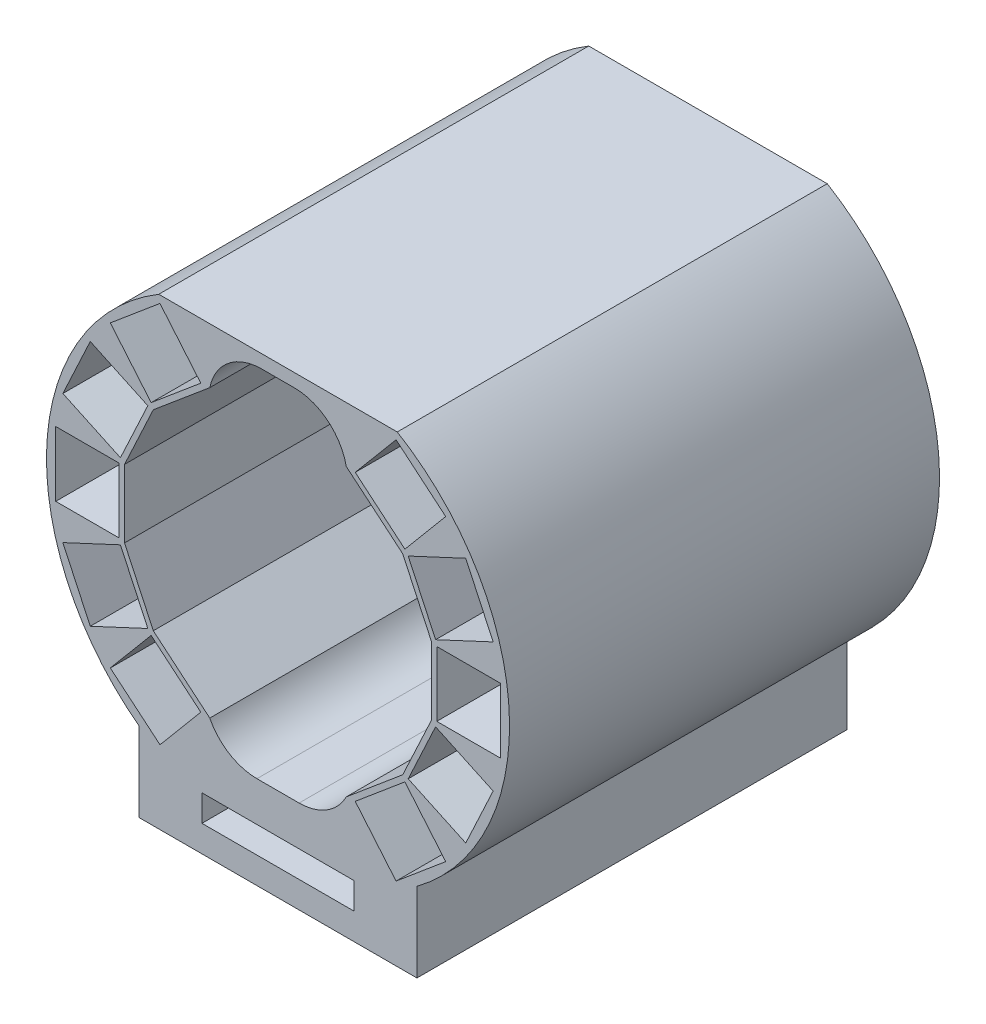
from build123d import *

# Parameters (mm, degrees)
SKETCH2_R                       = 4.79
BOSS_EXTRUDE2_DEPTH             = 65
SHELL4_START                    = 5
SHELL4_OUTLINE_R                = 4.79
SHELL4_DEPTH                    = 60
SKETCH3_W                       = 42
SKETCH3_H                       = 12
BOSS_EXTRUDE3_DEPTH             = 65
SKETCH4_W                       = 23
SKETCH4_H                       = 4
CUT_EXTRUDE1_DEPTH              = 30
BOSS_EXTRUDE4_DEPTH             = 60
CIRPATTERN2_COUNT               = 3
CIRPATTERN2_ANGLE               = 50
CIRPATTERN2_THE_OTHER_WAY_COUNT = 3
CIRPATTERN2_THE_OTHER_WAY_ANGLE = 50
CUT_EXTRUDE2_START              = -5
SKETCH5_4_W                     = 9.6
SKETCH5_4_H                     = 9.8
CUT_EXTRUDE2_DEPTH              = 65
CIRPATTERN3_COUNT               = 3
CIRPATTERN3_ANGLE               = 50
CIRPATTERN3_THE_OTHER_WAY_COUNT = 3
CIRPATTERN3_THE_OTHER_WAY_ANGLE = 50
MIRROR1_OUTLINE_W               = 9.6
MIRROR1_OUTLINE_H               = 9.8
MIRROR1_DEPTH                   = 65
MIRROR1_START                   = 5
MIRROR1_2_DEPTH                 = 60
FILLET1_R                       = 8


# Read off the part's stored shape, not the designer's step: Shell4, Mirror1
with BuildPart() as part:
    # Sketch2 → Boss-Extrude2 (new body)
    with BuildSketch(Plane.XY):
        with BuildLine():
            Line((18.027756377, 30), (-18.027756377, 30))
            ThreePointArc((-18.027756377, 30), (-34.954133403, 1.791244829), (-21, -28))
            Line((-21, -28), (21, -28))
            ThreePointArc((21, -28), (34.954133403, 1.791244829), (18.027756377, 30))
        make_face()
        Circle(SKETCH2_R, mode=Mode.SUBTRACT)
    extrude(amount=BOSS_EXTRUDE2_DEPTH)

    # Shell4 outline → Shell4 (cut)
    with BuildSketch(Plane.XY.offset(SHELL4_START)):
        with BuildLine():
            ThreePointArc((-17.464249197, 28), (-32.953872935, 1.744207141), (-20.322401433, -26))
            Line((-20.322401433, -26), (20.322401433, -26))
            ThreePointArc((20.322401433, -26), (32.953872935, 1.744207141), (17.464249197, 28))
            Line((17.464249197, 28), (-17.464249197, 28))
        make_face()
        Circle(SHELL4_OUTLINE_R, mode=Mode.SUBTRACT)
    extrude(amount=SHELL4_DEPTH, mode=Mode.SUBTRACT)

    # Sketch3 → Boss-Extrude3 (add)
    with BuildSketch(Plane.XY.offset(65)):
        with Locations((0, -34)):
            Rectangle(SKETCH3_W, SKETCH3_H)
    extrude(amount=-BOSS_EXTRUDE3_DEPTH)

    # Sketch4 → Cut-Extrude1 (cut)
    with BuildSketch(Plane.XY.offset(65)):
        with Locations((0, -34)):
            Rectangle(SKETCH4_W, SKETCH4_H)
    extrude(amount=-CUT_EXTRUDE1_DEPTH, mode=Mode.SUBTRACT)

    # Sketch5 → Boss-Extrude4 (add)
    with BuildSketch(Plane.XY.offset(5)):
        with BuildLine():
            Line((24, 0), (23.2, 0))
            Line((23.2, 0), (23.2, -6))
            Line((23.2, -6), (32.136427928, -7.5))
            ThreePointArc((32.136427928, -7.5), (32.411387807, -6.204993184), (32.634184531, -4.9))
            Line((32.634184531, -4.9), (24, -4.9))
            Line((24, -4.9), (24, 0))
        make_face()
        with BuildLine():
            Line((23.2, 6), (23.2, 0))
            Line((23.2, 0), (24, 0))
            Line((24, 0), (24, 4.9))
            Line((24, 4.9), (32.634184531, 4.9))
            ThreePointArc((32.634184531, 4.9), (32.411387807, 6.204993184), (32.136427928, 7.5))
            Line((32.136427928, 7.5), (23.2, 6))
        make_face()
        with BuildLine():
            Line((33, 0), (24, 0))
            Line((24, 0), (24, -4.9))
            Line((24, -4.9), (32.634184531, -4.9))
            ThreePointArc((32.634184531, -4.9), (32.908419056, -2.456818113), (33, 0))
        make_face()
        with BuildLine():
            Line((24, 4.9), (24, 0))
            Line((24, 0), (33, 0))
            ThreePointArc((33, 0), (32.908419056, 2.456818113), (32.634184531, 4.9))
            Line((32.634184531, 4.9), (24, 4.9))
        make_face()
    boss_extrude4 = extrude(amount=BOSS_EXTRUDE4_DEPTH)

    # CirPattern2: Boss-Extrude4 ×3 about axis
    cirpattern2_axis = Axis((0, 0, 0), (0, 0, -1))
    for i in range(1, CIRPATTERN2_COUNT):
        add(boss_extrude4.rotate(cirpattern2_axis, i * CIRPATTERN2_ANGLE / (CIRPATTERN2_COUNT - 1)))

    # CirPattern2 the other way: Boss-Extrude4 ×3 about axis
    cirpattern2_the_other_way_axis = Axis((0, 0, 0), (0, 0, 1))
    for i in range(1, CIRPATTERN2_THE_OTHER_WAY_COUNT):
        add(boss_extrude4.rotate(cirpattern2_the_other_way_axis, i * CIRPATTERN2_THE_OTHER_WAY_ANGLE / (CIRPATTERN2_THE_OTHER_WAY_COUNT - 1)))

    # Sketch5<4> → Cut-Extrude2 (cut)
    with BuildSketch(Plane.XY.offset(5).offset(CUT_EXTRUDE2_START)):
        with Locations((28.8, 0)):
            Rectangle(SKETCH5_4_W, SKETCH5_4_H)
    cut_extrude2 = extrude(amount=CUT_EXTRUDE2_DEPTH, mode=Mode.SUBTRACT)

    # CirPattern3: Cut-Extrude2 ×3 about axis
    cirpattern3_axis = Axis((0, 0, 0), (0, 0, 1))
    for i in range(1, CIRPATTERN3_COUNT):
        add(cut_extrude2.rotate(cirpattern3_axis, i * CIRPATTERN3_ANGLE / (CIRPATTERN3_COUNT - 1)), mode=Mode.SUBTRACT)

    # CirPattern3 the other way: Cut-Extrude2 ×3 about axis
    cirpattern3_the_other_way_axis = Axis((0, 0, 0), (0, 0, -1))
    for i in range(1, CIRPATTERN3_THE_OTHER_WAY_COUNT):
        add(cut_extrude2.rotate(cirpattern3_the_other_way_axis, i * CIRPATTERN3_THE_OTHER_WAY_ANGLE / (CIRPATTERN3_THE_OTHER_WAY_COUNT - 1)), mode=Mode.SUBTRACT)

    # Mirror1 outline → Mirror1 (cut)
    with BuildSketch(Plane.XY):
        with Locations((-28.8, 0)):
            Rectangle(MIRROR1_OUTLINE_W, MIRROR1_OUTLINE_H)
        Polygon((-19.680557406, 14.583746438), (-28.381112162, 18.640881751), (-32.522771127, 9.759065438), (-23.822216371, 5.701930125), align=None)
        Polygon((-28.381112162, -18.640881751), (-19.680557406, -14.583746438), (-23.822216371, -5.701930125), (-32.522771127, -9.759065438), align=None)
        Polygon((-11.673284861, 21.534725922), (-17.844045914, 28.888752576), (-25.351281457, 22.589434001), (-19.180520404, 15.235407347), align=None)
        Polygon((-17.844045914, -28.888752576), (-11.673284861, -21.534725922), (-19.180520404, -15.235407347), (-25.351281457, -22.589434001), align=None)
    extrude(amount=MIRROR1_DEPTH, mode=Mode.SUBTRACT)

    # Mirror1 2 outline → Mirror1 2 (add)
    with BuildSketch(Plane.XY.offset(MIRROR1_START)):
        with BuildLine():
            ThreePointArc((-31.647445046, 9.350894183), (-32.217768235, 7.14250726), (-32.63418453, 4.9))
            Line((-32.63418453, 4.9), (-24, 4.9))
            Line((-24, 4.9), (-24, -4.9))
            Line((-24, -4.9), (-32.63418453, -4.9))
            ThreePointArc((-32.63418453, -4.9), (-32.217768234, -7.14250726), (-31.647445046, -9.350894183))
            Line((-31.647445046, -9.350894183), (-23.822216371, -5.701930125))
            Line((-23.822216371, -5.701930125), (-19.680557406, -14.583746438))
            Line((-19.680557406, -14.583746438), (-27.505786081, -18.232710496))
            ThreePointArc((-27.505786081, -18.232710496), (-26.18066023, -20.089127157), (-24.73046724, -21.849576428))
            Line((-24.73046724, -21.849576428), (-19.180520404, -15.235407347))
            Line((-19.180520404, -15.235407347), (-11.673284861, -21.534725922))
            Line((-11.673284861, -21.534725922), (-15.420094693, -26))
            Line((-15.420094693, -26), (-12.888229067, -26))
            Line((-12.888229067, -26), (-10.316405886, -21.628956738))
            Line((-10.316405886, -21.628956738), (-18.852681319, -14.466171171))
            Line((-18.852681319, -14.466171171), (-23.2, -5.143316173))
            Line((-23.2, -5.143316173), (-23.2, 5.143316173))
            Line((-23.2, 5.143316173), (-18.852681319, 14.466171171))
            Line((-18.852681319, 14.466171171), (-10.316405886, 21.628956738))
            Line((-10.316405886, 21.628956738), (-14.064983918, 28))
            Line((-14.064983918, 28), (-17.098293955, 28))
            Line((-17.098293955, 28), (-11.673284861, 21.534725922))
            Line((-11.673284861, 21.534725922), (-19.180520404, 15.235407347))
            Line((-19.180520404, 15.235407347), (-24.73046724, 21.849576428))
            ThreePointArc((-24.73046724, 21.849576428), (-26.18066023, 20.089127157), (-27.505786081, 18.232710496))
            Line((-27.505786081, 18.232710496), (-19.680557406, 14.583746438))
            Line((-19.680557406, 14.583746438), (-23.822216371, 5.701930125))
            Line((-23.822216371, 5.701930125), (-31.647445046, 9.350894183))
        make_face()
    extrude(amount=MIRROR1_2_DEPTH)

    # Fillet1
    # the kernel refuses this fillet: 8 mm, written as the material it adds along each edge
    with BuildSketch(Plane(origin=(14.064983918, 28, 5), x_dir=(-0.507111132951345, -0.8618806755211555, 0), z_dir=(0, 0, 1))) as fillet1_piece_1:
        with BuildLine():
            CenterArc((12.767888624, -5.924532666), FILLET1_R, 132.220297842, 78.251296778)
            Line((5.87284322, -9.98142173), (5.734942312, -10.062559511))
            Line((5.734942312, -10.062559511), (-0.137900908, -0.081137781))
            Line((-0.137900908, -0.081137781), (0, 0.16))
            ThreePointArc((0, 0.16), (3.696012361, 0.16), (7.284507445, 0.118490653))
            Line((7.284507445, 0.118490653), (7.392024723, 0))
        make_face()
    extrude(amount=60)
    with BuildSketch(Plane(origin=(-12.888229067, -26, 5), x_dir=(0.5071111329155005, 0.8618806755422457, 0), z_dir=(0, 0, 1))) as fillet1_piece_2:
        with BuildLine():
            CenterArc((11.814726499, -4.304548479), FILLET1_R, 147.447746104, 63.023848513)
            Line((4.919681094, -8.361437543), (4.781780186, -8.442575324))
            Line((4.781780186, -8.442575324), (-0.137900908, -0.081137781))
            Line((-0.137900908, -0.081137781), (0, 0.16))
            ThreePointArc((0, 0.16), (2.535758943, 0.16), (4.936653714, 0.08609097))
            Line((4.936653714, 0.08609097), (5.071517886, 0))
        make_face()
    extrude(amount=60)
    with BuildSketch(Plane(origin=(-14.064983918, 28, 5), x_dir=(1, 0, 0), z_dir=(0, 0, 1))) as fillet1_piece_3:
        with BuildLine():
            CenterArc((11.580978682, -8), FILLET1_R, 90, 78.251296781)
            Line((3.748578032, -6.371043262), (3.591930019, -6.338464127))
            ThreePointArc((3.591930019, -6.338464127), (1.736388108, -3.266659412), (-0.137900908, -0.081137781))
            Line((-0.137900908, -0.081137781), (0, 0.16))
            Line((0, 0.16), (11.580978682, 0.16))
            Line((11.580978682, 0.16), (11.580978682, 0))
        make_face()
    extrude(amount=60)
    with BuildSketch(Plane(origin=(12.888229067, -26, 65), x_dir=(-1, 0, 0), z_dir=(0, 0, -1))) as fillet1_piece_4:
        with BuildLine():
            CenterArc((9.701386491, 8), FILLET1_R, 206.97615149, 63.02384851)
            Line((2.571823181, 4.371043262), (2.429231915, 4.298464127))
            ThreePointArc((2.429231915, 4.298464127), (1.148010682, 2.266659412), (-0.137900908, 0.081137781))
            Line((-0.137900908, 0.081137781), (0, -0.16))
            Line((0, -0.16), (9.701386491, -0.16))
            Line((9.701386491, -0.16), (9.701386491, 0))
        make_face()
    extrude(amount=60)


solid = part.part
